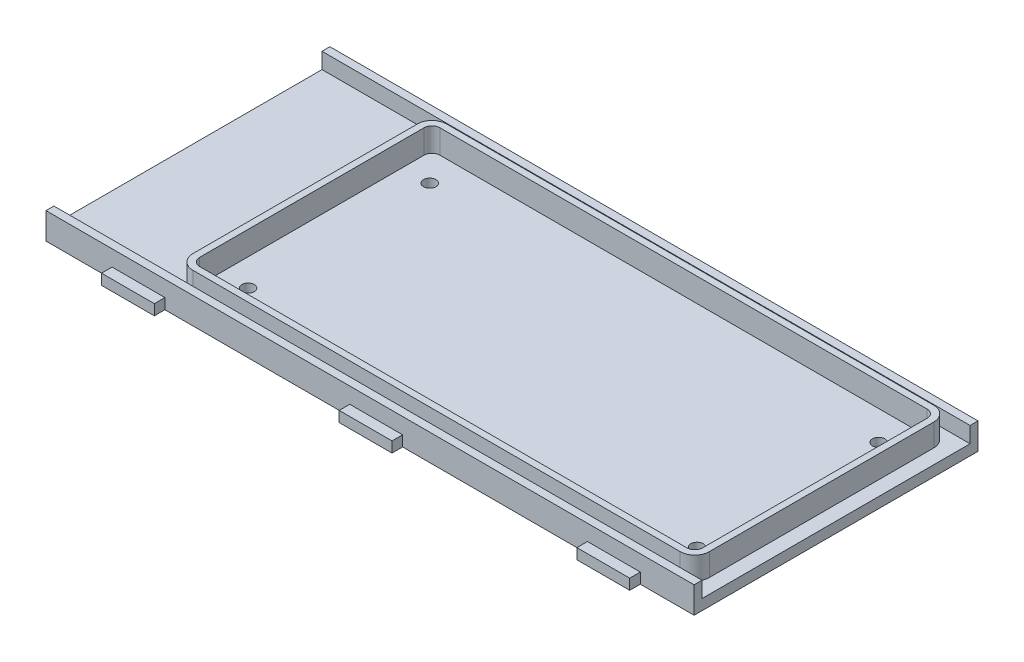
from build123d import *

# Parameters (mm, degrees)
BOSS_EXTRUDE1_DEPTH = 2
SKETCH2_W           = 122.7
SKETCH2_H           = 1.5
BOSS_EXTRUDE2_DEPTH = 3
CUT_EXTRUDE1_DEPTH  = 0.25
BOSS_EXTRUDE3_START = 4.25
BOSS_EXTRUDE3_DEPTH = 4.25
SKETCH5_R           = 1.175
CUT_EXTRUDE2_DEPTH  = 68.954676991


with BuildPart() as part:
    # Sketch1 → Boss-Extrude1 (new body)
    with BuildSketch(Plane(origin=(0, 0, 0), x_dir=(1, 0, 0), z_dir=(0, 1, 0))):
        Polygon((-61.35, 26.875), (-48.84, 26.875), (-48.84, 28.875), (-38.84, 28.875), (-38.84, 26.875), (-3.84, 26.875), (-3.84, 28.875), (6.16, 28.875), (6.16, 26.875), (41.16, 26.875), (41.16, 28.875), (51.16, 28.875), (51.16, 26.875), (61.35, 26.875), (61.35, -26.875), (51.16, -26.875), (51.16, -28.875), (41.16, -28.875), (41.16, -26.875), (6.16, -26.875), (6.16, -28.875), (-3.84, -28.875), (-3.84, -26.875), (-38.84, -26.875), (-38.84, -28.875), (-48.84, -28.875), (-48.84, -26.875), (-61.35, -26.875), align=None)
    extrude(amount=BOSS_EXTRUDE1_DEPTH)

    # Sketch2 → Boss-Extrude2 (add)
    with BuildSketch(Plane(origin=(0, 2, 0), x_dir=(1, 0, 0), z_dir=(0, 1, 0))):
        with Locations((0, 26.125)):
            Rectangle(SKETCH2_W, SKETCH2_H)
        with Locations((0, -26.125)):
            Rectangle(SKETCH2_W, SKETCH2_H)
    extrude(amount=BOSS_EXTRUDE2_DEPTH)

    # Sketch3 → Cut-Extrude1 (cut)
    with BuildSketch(Plane(origin=(0, 2, 0), x_dir=(1, 0, 0), z_dir=(0, 1, 0))):
        with BuildLine():
            Line((-36.4, 22.75), (55.85, 22.75))
            ThreePointArc((55.85, 22.75), (56.910660172, 22.310660172), (57.35, 21.25))
            Line((57.35, 21.25), (57.35, -21.25))
            ThreePointArc((57.35, -21.25), (56.910660172, -22.310660172), (55.85, -22.75))
            Line((55.85, -22.75), (-36.4, -22.75))
            ThreePointArc((-36.4, -22.75), (-37.460660172, -22.310660172), (-37.9, -21.25))
            Line((-37.9, -21.25), (-37.9, 21.25))
            ThreePointArc((-37.9, 21.25), (-37.460660172, 22.310660172), (-36.4, 22.75))
        make_face()
    extrude(amount=-CUT_EXTRUDE1_DEPTH, mode=Mode.SUBTRACT)

    # Sketch4 → Boss-Extrude3 (add)
    with BuildSketch(Plane(origin=(0, 2, 0), x_dir=(1, 0, 0), z_dir=(0, 1, 0)).offset(BOSS_EXTRUDE3_START)):
        with BuildLine():
            Line((55.85, 24), (-36.4, 24))
            ThreePointArc((-36.4, 24), (-38.344543648, 23.194543648), (-39.15, 21.25))
            Line((-39.15, 21.25), (-39.15, -21.25))
            ThreePointArc((-39.15, -21.25), (-38.344543648, -23.194543648), (-36.4, -24))
            Line((-36.4, -24), (55.85, -24))
            ThreePointArc((55.85, -24), (57.794543648, -23.194543648), (58.6, -21.25))
            Line((58.6, -21.25), (58.6, 21.25))
            ThreePointArc((58.6, 21.25), (57.794543648, 23.194543648), (55.85, 24))
        make_face()
        with BuildLine():
            Line((55.85, 22.75), (-36.4, 22.75))
            ThreePointArc((-36.4, 22.75), (-37.460660172, 22.310660172), (-37.9, 21.25))
            Line((-37.9, 21.25), (-37.9, -21.25))
            ThreePointArc((-37.9, -21.25), (-37.460660172, -22.310660172), (-36.4, -22.75))
            Line((-36.4, -22.75), (55.85, -22.75))
            ThreePointArc((55.85, -22.75), (56.910660172, -22.310660172), (57.35, -21.25))
            Line((57.35, -21.25), (57.35, 21.25))
            ThreePointArc((57.35, 21.25), (56.910660172, 22.310660172), (55.85, 22.75))
        make_face(mode=Mode.SUBTRACT)
    extrude(amount=-BOSS_EXTRUDE3_DEPTH)

    # Sketch5 → Cut-Extrude2 (cut, through all)
    with BuildSketch(Plane(origin=(0, 1.75, 0), x_dir=(1, 0, 0), z_dir=(0, 1, 0))):
        with Locations((-32.775, 17.2)):
            Circle(SKETCH5_R)
        with Locations((52.225, 17.2)):
            Circle(SKETCH5_R)
        with Locations((52.225, -17.2)):
            Circle(SKETCH5_R)
        with Locations((-32.775, -17.2)):
            Circle(SKETCH5_R)
    extrude(amount=-CUT_EXTRUDE2_DEPTH, mode=Mode.SUBTRACT)


solid = part.part
